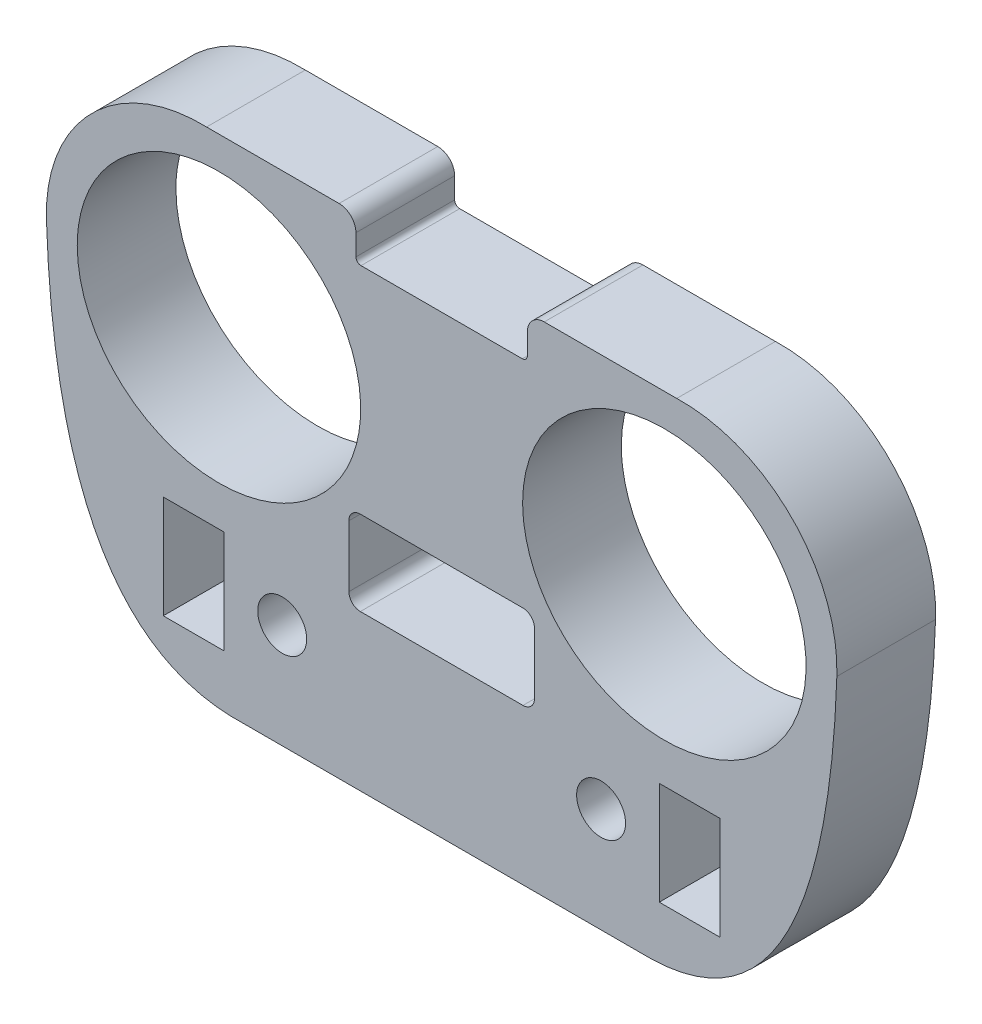
from build123d import *

# Parameters (mm, degrees)
MODEL_W             = 3.6
MODEL_H             = 6.1
MODEL_R             = 1.45
BOSS_EXTRUDE1_DEPTH = 5.85
FILLET1_R           = 0.3
FILLET2_R           = 1


with BuildPart() as part:
    # Model → Boss-Extrude1 (new body)
    with BuildSketch(Plane.XY):
        with BuildLine():
            Line((549.596103149, 594.649674665), (540.7427075, 594.649674665))
            ThreePointArc((540.7427075, 594.649674665), (533.932980762, 591.943953999), (531.251426748, 585.124674665))
            add(Edge.make_bspline(
                [(531.251426748, 585.124674665), (531.926909632, 565.444526899), (542.192175731, 565.124674665)],
                knots=[0, 0, 0, 1, 1, 1], degree=2))
            Line((542.192175731, 565.124674665), (567.160030567, 565.124674665))
            add(Edge.make_bspline(
                [(578.10077955, 585.124674665), (577.425296665, 565.444526899), (567.160030567, 565.124674665)],
                knots=[0, 0, 0, 1, 1, 1], degree=2))
            ThreePointArc((578.10077955, 585.124674665), (575.419225536, 591.943953999), (568.609498798, 594.649674665))
            Line((568.609498798, 594.649674665), (559.756103149, 594.649674665))
            Line((559.756103149, 594.649674665), (559.756103149, 592.109674665))
            Line((559.756103149, 592.109674665), (549.596103149, 592.109674665))
            Line((549.596103149, 592.109674665), (549.596103149, 594.649674665))
        make_face()
        with Locations((539.976103149, 571.324674665)):
            Rectangle(MODEL_W, MODEL_H, mode=Mode.SUBTRACT)
        with Locations((545.226103149, 571.324674665)):
            Circle(MODEL_R, mode=Mode.SUBTRACT)
        with Locations((564.126103149, 571.324674665)):
            Circle(MODEL_R, mode=Mode.SUBTRACT)
        with Locations((569.376103149, 571.324674665)):
            Rectangle(MODEL_W, MODEL_H, mode=Mode.SUBTRACT)
        with BuildLine():
            Line((554.676103149, 574.334674665), (549.856103149, 574.334674665))
            ThreePointArc((549.856103149, 574.334674665), (549.375270538, 574.533842054), (549.176103149, 575.014674665))
            Line((549.176103149, 575.014674665), (549.176103149, 578.654674665))
            ThreePointArc((549.176103149, 578.654674665), (549.375270538, 579.135507276), (549.856103149, 579.334674665))
            Line((549.856103149, 579.334674665), (554.676103149, 579.334674665))
            Line((554.676103149, 579.334674665), (559.496103149, 579.334674665))
            ThreePointArc((559.496103149, 579.334674665), (559.97693576, 579.135507276), (560.176103149, 578.654674665))
            Line((560.176103149, 578.654674665), (560.176103149, 575.014674665))
            ThreePointArc((560.176103149, 575.014674665), (559.97693576, 574.533842054), (559.496103149, 574.334674665))
            Line((559.496103149, 574.334674665), (554.676103149, 574.334674665))
        make_face(mode=Mode.SUBTRACT)
        with BuildLine():
            add(Edge.make_bspline(
                [(533.076103149, 584.734674665), (533.076103149, 570.878268205), (545.676103149, 577.806471435), (558.276103149, 584.734674665), (545.676103149, 591.662877895), (533.076103149, 598.591081126), (533.076103149, 584.734674665)],
                knots=[0, 0, 0, 2.094395102, 2.094395102, 4.188790205, 4.188790205, 6.283185307, 6.283185307, 6.283185307], degree=2, weights=[1, 0.5, 1, 0.5, 1, 0.5, 1]))
        make_face(mode=Mode.SUBTRACT)
        with BuildLine():
            add(Edge.make_bspline(
                [(559.476103149, 584.734674665), (559.476103149, 570.878268205), (572.076103149, 577.806471435), (584.676103149, 584.734674665), (572.076103149, 591.662877895), (559.476103149, 598.591081126), (559.476103149, 584.734674665)],
                knots=[0, 0, 0, 2.094395102, 2.094395102, 4.188790205, 4.188790205, 6.283185307, 6.283185307, 6.283185307], degree=2, weights=[1, 0.5, 1, 0.5, 1, 0.5, 1]))
        make_face(mode=Mode.SUBTRACT)
    extrude(amount=BOSS_EXTRUDE1_DEPTH)

    # Fillet1
    fillet1_edges = [part.edges().sort_by_distance(p)[0] for p in [
        (559.756103149, 592.109674665, 2.925),
        (549.596103149, 592.109674665, 2.925),
    ]]
    fillet(fillet1_edges, radius=FILLET1_R)

    # Fillet2
    fillet2_edges = [part.edges().sort_by_distance(p)[0] for p in [
        (559.756103149, 594.649674665, 2.925),
        (549.596103149, 594.649674665, 2.925),
    ]]
    fillet(fillet2_edges, radius=FILLET2_R)


solid = part.part
